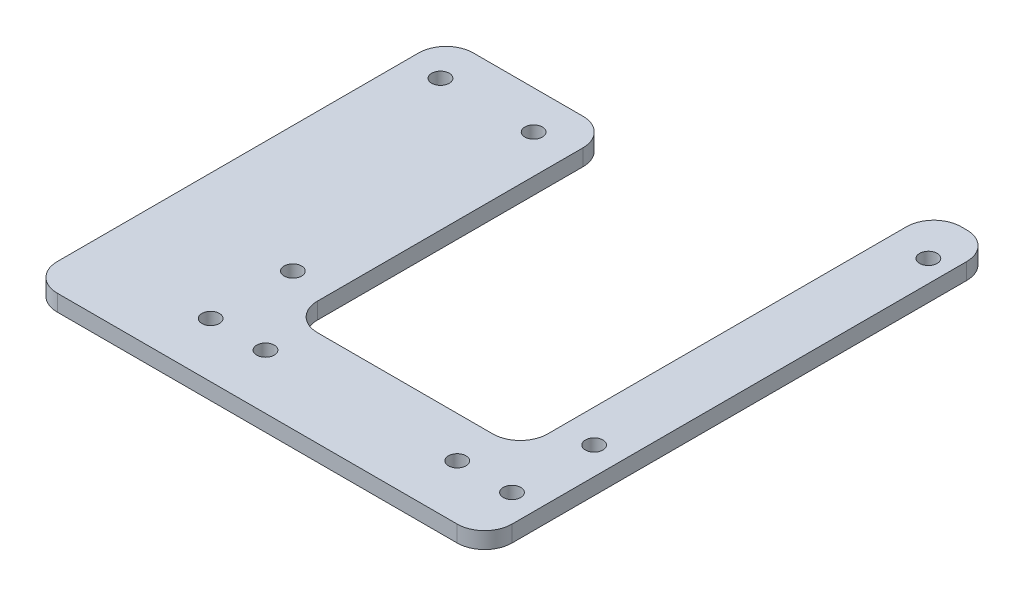
from build123d import *

# Parameters (mm, degrees)
EXTRUDE_1049_DEPTH      = 3
SKETCH_2_R              = 37.5
SKETCH_2_R_2            = 1.6
CUT_EXTRUDE_1714_DEPTH  = 3
SKETCH_8_W              = 65
SKETCH_8_H              = 25
CUT_EXTRUDE_2586_DEPTH  = 3
SKETCH_41_W             = 55
SKETCH_41_H             = 60
CUT_EXTRUDE_2_DEPTH     = 10
SKETCH_10_W             = 65
SKETCH_10_H             = 30
CUT_EXTRUDE_3792_DEPTH  = 3
SKETCH_11_R             = 1.6
SKETCH_11_W             = 42
SKETCH_11_H             = 28
CUT_EXTRUDE_4901_DEPTH  = 3
SKETCH_13_R             = 1.6
CUT_EXTRUDE_5557_DEPTH  = 3
SKETCH_14_R             = 2
CUT_EXTRUDE_5907_DEPTH  = 3
SKETCH_15_R             = 2
CUT_EXTRUDE_6167_DEPTH  = 3
SKETCH_16_R             = 1.6
CUT_EXTRUDE_6674_DEPTH  = 3
SKETCH_19_R             = 2
SKETCH_19_R_2           = 2.5
CUT_EXTRUDE_7840_DEPTH  = 3
SKETCH_21_R             = 1.6
CUT_EXTRUDE_7992_DEPTH  = 3
CUT_EXTRUDE_9_DEPTH     = 10
SKETCH_33_R             = 1.6
PC_DEPTH                = 10
SKETCH_36_R             = 1.6
CUT_EXTRUDE_9335_DEPTH  = 345.206333469
SKETCH_29_R             = 1.6
CUT_EXTRUDE_9717_DEPTH  = 10
SKETCH_39_R             = 1.6
CUT_EXTRUDE_10319_DEPTH = 10
SKETCH_42_W             = 40
SKETCH_42_H             = 40
CUT_EXTRUDE_11_DEPTH    = 10
SKETCH_34_R             = 1.6
UWB_DEPTH               = 10
SKETCH_47_R             = 1.6
CUT_EXTRUDE_13152_DEPTH = 345.206333469
SKETCH_48_R             = 1.6
CUT_EXTRUDE_14_DEPTH    = 345.206333469
CUT_EXTRUDE_6623_DEPTH  = 10
FILLET_13947_R          = 5
FILLET_14546_R          = 2
SKETCH_53_R             = 1.6
RFID_DEPTH              = 10
SKETCH_54_R             = 1.6
CUT_EXTRUDE_19167_DEPTH = 10
SKETCH_55_OUTSIDE_W     = 518.68
SKETCH_55_OUTSIDE_H     = 706.68
CUT_EXTRUDE_17_DEPTH    = 10
FILLET_1_R              = 5
SKETCH_56_W             = 16
SKETCH_56_H             = 59
CUT_EXTRUDE_18_DEPTH    = 10
SKETCH_57_R             = 1.55
CUT_EXTRUDE_19_DEPTH    = 10
SKETCH_59_R             = 1.6
CUT_EXTRUDE_20_DEPTH    = 10
FILLET_2_R              = 2
SKETCH_60_W             = 42
SKETCH_60_H             = 75.5
CUT_EXTRUDE_21_DEPTH    = 10
SKETCH_61_W             = 23.311710065
SKETCH_61_H             = 85.935142547
CUT_EXTRUDE_22_DEPTH    = 10
SKETCH_62_W             = 30
SKETCH_62_H             = 17.052631579
CUT_EXTRUDE_23_DEPTH    = 10
SKETCH_63_R             = 1.6
CUT_EXTRUDE_24_DEPTH    = 10
FILLET_3_R              = 5


with BuildPart() as part:
    # 草图1 → Extrude 1049 (new body)
    with BuildSketch(Plane(origin=(0, 0, 0), x_dir=(1, 0, 0), z_dir=(0, 1, 0))):
        Polygon((190, 287), (101.545, 287), (79.605689771, 249), (-79.605689771, 249), (-101.545, 287), (-190, 287), (-190, 0), (-190, -281), (-144.091695942, -281), (-98.660254038, -281), (-74.411542732, -239), (74.411542732, -239), (98.660254038, -281), (144.091695942, -281), (190, -281), (190, 0), align=None)
    extrude(amount=EXTRUDE_1049_DEPTH)

    # 草图2 → Cut-Extrude 1714 (cut)
    with BuildSketch(Plane(origin=(0, 3, 0), x_dir=(1, 0, 0), z_dir=(0, 1, 0))):
        Circle(SKETCH_2_R)
        with Locations((38.97114317, 22.5)):
            Circle(SKETCH_2_R_2)
        with Locations((0, -45)):
            Circle(SKETCH_2_R_2)
        with Locations((-38.97114317, 22.5)):
            Circle(SKETCH_2_R_2)
    extrude(amount=-CUT_EXTRUDE_1714_DEPTH, mode=Mode.SUBTRACT)

    # 草图8 → Cut-Extrude 2586 (cut)
    with BuildSketch(Plane(origin=(0, 3, 0), x_dir=(1, 0, 0), z_dir=(0, 1, 0))):
        with Locations((115, -161.5)):
            Rectangle(SKETCH_8_W, SKETCH_8_H)
        with Locations((-115, -161.5)):
            Rectangle(SKETCH_8_W, SKETCH_8_H)
    extrude(amount=-CUT_EXTRUDE_2586_DEPTH, mode=Mode.SUBTRACT)

    # 草图41 → 减重过线孔2 (cut)
    with BuildSketch(Plane(origin=(0, 3, 0), x_dir=(1, 0, 0), z_dir=(0, 1, 0))):
        with Locations((-102.5, 70)):
            Rectangle(SKETCH_41_W, SKETCH_41_H)
        with Locations((102.5, 70)):
            Rectangle(SKETCH_41_W, SKETCH_41_H)
        with Locations((102.5, -70)):
            Rectangle(SKETCH_41_W, SKETCH_41_H)
        with Locations((-102.5, -70)):
            Rectangle(SKETCH_41_W, SKETCH_41_H)
    extrude(amount=-CUT_EXTRUDE_2_DEPTH, mode=Mode.SUBTRACT)

    # 草图10 → Cut-Extrude 3792 (cut)
    with BuildSketch(Plane(origin=(0, 3, 0), x_dir=(1, 0, 0), z_dir=(0, 1, 0))):
        with Locations((-130, 167)):
            Rectangle(SKETCH_10_W, SKETCH_10_H)
        with Locations((130, 167)):
            Rectangle(SKETCH_10_W, SKETCH_10_H)
    extrude(amount=-CUT_EXTRUDE_3792_DEPTH, mode=Mode.SUBTRACT)

    # 草图11 → Cut-Extrude 4901 (cut)
    with BuildSketch(Plane(origin=(0, 3, 0), x_dir=(1, 0, 0), z_dir=(0, 1, 0))):
        with Locations((-153.5, 259)):
            Circle(SKETCH_11_R)
        with Locations((-162.5, 259)):
            Circle(SKETCH_11_R)
        with Locations((-153.5, 209)):
            Circle(SKETCH_11_R)
        with Locations((-162.5, 209)):
            Circle(SKETCH_11_R)
        with Locations((153.5, 259)):
            Circle(SKETCH_11_R)
        with Locations((162.5, 259)):
            Circle(SKETCH_11_R)
        with Locations((153.5, 209)):
            Circle(SKETCH_11_R)
        with Locations((162.5, 209)):
            Circle(SKETCH_11_R)
        with Locations((162.5, -209)):
            Circle(SKETCH_11_R)
        with Locations((153.5, -209)):
            Circle(SKETCH_11_R)
        with Locations((162.5, -259)):
            Circle(SKETCH_11_R)
        with Locations((153.5, -259)):
            Circle(SKETCH_11_R)
        with Locations((-162.5, -209)):
            Circle(SKETCH_11_R)
        with Locations((-153.5, -209)):
            Circle(SKETCH_11_R)
        with Locations((-153.5, -259)):
            Circle(SKETCH_11_R)
        with Locations((-162.5, -259)):
            Circle(SKETCH_11_R)
        with Locations((-158, 234)):
            Rectangle(SKETCH_11_W, SKETCH_11_H)
        with Locations((158, 234)):
            Rectangle(SKETCH_11_W, SKETCH_11_H)
        with Locations((158, -234)):
            Rectangle(SKETCH_11_W, SKETCH_11_H)
        with Locations((-158, -234)):
            Rectangle(SKETCH_11_W, SKETCH_11_H)
    extrude(amount=-CUT_EXTRUDE_4901_DEPTH, mode=Mode.SUBTRACT)

    # 草图13 → Cut-Extrude 5557 (cut)
    with BuildSketch(Plane(origin=(0, 3, 0), x_dir=(1, 0, 0), z_dir=(0, 1, 0))):
        with Locations((25, 176)):
            Circle(SKETCH_13_R)
        with Locations((25, 226)):
            Circle(SKETCH_13_R)
        with Locations((-25, 226)):
            Circle(SKETCH_13_R)
        with Locations((-25, 176)):
            Circle(SKETCH_13_R)
    extrude(amount=-CUT_EXTRUDE_5557_DEPTH, mode=Mode.SUBTRACT)

    # 草图14 → Cut-Extrude 5907 (cut)
    with BuildSketch(Plane(origin=(0, 3, 0), x_dir=(1, 0, 0), z_dir=(0, 1, 0))):
        with Locations((-47.5, 239)):
            Circle(SKETCH_14_R)
        with Locations((-47.5, 214)):
            Circle(SKETCH_14_R)
        with Locations((47.5, 214)):
            Circle(SKETCH_14_R)
        with Locations((47.5, 239)):
            Circle(SKETCH_14_R)
        with Locations((-47.5, -207)):
            Circle(SKETCH_14_R)
        with Locations((-47.5, -232)):
            Circle(SKETCH_14_R)
        with Locations((47.5, -232)):
            Circle(SKETCH_14_R)
        with Locations((47.5, -207)):
            Circle(SKETCH_14_R)
    extrude(amount=-CUT_EXTRUDE_5907_DEPTH, mode=Mode.SUBTRACT)

    # 草图15 → Cut-Extrude 6167 (cut)
    with BuildSketch(Plane(origin=(0, 3, 0), x_dir=(1, 0, 0), z_dir=(0, 1, 0))):
        with Locations((155, 47.5)):
            Circle(SKETCH_15_R)
        with Locations((180, 47.5)):
            Circle(SKETCH_15_R)
        with Locations((180, -47.5)):
            Circle(SKETCH_15_R)
        with Locations((155, -47.5)):
            Circle(SKETCH_15_R)
        with Locations((-155, -47.5)):
            Circle(SKETCH_15_R)
        with Locations((-180, -47.5)):
            Circle(SKETCH_15_R)
        with Locations((-180, 47.5)):
            Circle(SKETCH_15_R)
        with Locations((-155, 47.5)):
            Circle(SKETCH_15_R)
    extrude(amount=-CUT_EXTRUDE_6167_DEPTH, mode=Mode.SUBTRACT)

    # 草图16 → Cut-Extrude 6674 (cut)
    with BuildSketch(Plane(origin=(0, 3, 0), x_dir=(1, 0, 0), z_dir=(0, 1, 0))):
        with Locations((-64, 229)):
            Circle(SKETCH_16_R)
        with Locations((-64, 117)):
            Circle(SKETCH_16_R)
        with Locations((-64, 5)):
            Circle(SKETCH_16_R)
        with Locations((-64, -107)):
            Circle(SKETCH_16_R)
        with Locations((-64, -219)):
            Circle(SKETCH_16_R)
        with Locations((64, 229)):
            Circle(SKETCH_16_R)
        with Locations((64, -107)):
            Circle(SKETCH_16_R)
        with Locations((64, 5)):
            Circle(SKETCH_16_R)
        with Locations((64, 117)):
            Circle(SKETCH_16_R)
        with Locations((64, -219)):
            Circle(SKETCH_16_R)
    extrude(amount=-CUT_EXTRUDE_6674_DEPTH, mode=Mode.SUBTRACT)

    # 草图19 → Cut-Extrude 7840 (cut)
    with BuildSketch(Plane(origin=(0, 3, 0), x_dir=(1, 0, 0), z_dir=(0, 1, 0))):
        with Locations((-177.5, -78)):
            Circle(SKETCH_19_R)
        with Locations((-177.5, -94)):
            Circle(SKETCH_19_R_2)
        with Locations((-177.5, 94)):
            Circle(SKETCH_19_R_2)
        with Locations((-177.5, 78)):
            Circle(SKETCH_19_R)
        with Locations((177.5, -94)):
            Circle(SKETCH_19_R_2)
        with Locations((177.5, -78)):
            Circle(SKETCH_19_R)
        with Locations((177.5, 78)):
            Circle(SKETCH_19_R)
        with Locations((177.5, 94)):
            Circle(SKETCH_19_R_2)
    extrude(amount=-CUT_EXTRUDE_7840_DEPTH, mode=Mode.SUBTRACT)

    # 草图21 → Cut-Extrude 7992 (cut)
    with BuildSketch(Plane(origin=(0, 3, 0), x_dir=(1, 0, 0), z_dir=(0, 1, 0))):
        with Locations((0, -93)):
            Circle(SKETCH_21_R)
    extrude(amount=-CUT_EXTRUDE_7992_DEPTH, mode=Mode.SUBTRACT)

    # 草图32 → 切除-拉伸9 (cut)
    with BuildSketch(Plane(origin=(0, 3, 0), x_dir=(1, 0, 0), z_dir=(0, 1, 0))):
        with BuildLine():
            Line((-34.5, -190), (34.5, -190))
            ThreePointArc((34.5, -190), (36.621320344, -189.121320344), (37.5, -187))
            Line((37.5, -187), (37.5, -133))
            ThreePointArc((37.5, -133), (36.621320344, -130.878679656), (34.5, -130))
            Line((34.5, -130), (-34.5, -130))
            ThreePointArc((-34.5, -130), (-36.621320344, -130.878679656), (-37.5, -133))
            Line((-37.5, -133), (-37.5, -187))
            ThreePointArc((-37.5, -187), (-36.621320344, -189.121320344), (-34.5, -190))
        make_face()
    extrude(amount=-CUT_EXTRUDE_9_DEPTH, mode=Mode.SUBTRACT)

    # 草图33 → PC座固定孔 (cut)
    with BuildSketch(Plane(origin=(0, 3, 0), x_dir=(1, 0, 0), z_dir=(0, 1, 0))):
        with Locations((-42.5, -120.5)):
            Circle(SKETCH_33_R)
        with Locations((42.5, -120.5)):
            Circle(SKETCH_33_R)
    extrude(amount=-PC_DEPTH, mode=Mode.SUBTRACT)

    # 草图36 → Cut-Extrude 9335 (cut, through all)
    with BuildSketch(Plane(origin=(0, 3, 0), x_dir=(1, 0, 0), z_dir=(0, 1, 0))):
        with Locations((-80, -231)):
            Circle(SKETCH_36_R)
        with Locations((-80, -219)):
            Circle(SKETCH_36_R)
        with Locations((80, -219)):
            Circle(SKETCH_36_R)
        with Locations((80, -231)):
            Circle(SKETCH_36_R)
        with Locations((-80, 241)):
            Circle(SKETCH_36_R)
        with Locations((-80, 229)):
            Circle(SKETCH_36_R)
        with Locations((80, 229)):
            Circle(SKETCH_36_R)
        with Locations((80, 241)):
            Circle(SKETCH_36_R)
    extrude(amount=-CUT_EXTRUDE_9335_DEPTH, mode=Mode.SUBTRACT)

    # 草图29 → Cut-Extrude 9717 (cut)
    with BuildSketch(Plane(origin=(0, 3, 0), x_dir=(1, 0, 0), z_dir=(0, 1, 0))):
        with Locations((48, 120)):
            Circle(SKETCH_29_R)
        with Locations((0, 86)):
            Circle(SKETCH_29_R)
        with Locations((0, 154)):
            Circle(SKETCH_29_R)
        with Locations((-48, 120)):
            Circle(SKETCH_29_R)
        with BuildLine():
            Line((40, 98), (40, 142))
            ThreePointArc((40, 142), (39.121320344, 144.121320344), (37, 145))
            Line((37, 145), (-37, 145))
            ThreePointArc((-37, 145), (-39.121320344, 144.121320344), (-40, 142))
            Line((-40, 142), (-40, 98))
            ThreePointArc((-40, 98), (-39.121320344, 95.878679656), (-37, 95))
            Line((-37, 95), (37, 95))
            ThreePointArc((37, 95), (39.121320344, 95.878679656), (40, 98))
        make_face()
    extrude(amount=-CUT_EXTRUDE_9717_DEPTH, mode=Mode.SUBTRACT)

    # 草图39 → Cut-Extrude 10319 (cut)
    with BuildSketch(Plane(origin=(0, 3, 0), x_dir=(1, 0, 0), z_dir=(0, 1, 0))):
        with Locations((185, -271)):
            Circle(SKETCH_39_R)
        with Locations((185, -256)):
            Circle(SKETCH_39_R)
        with Locations((130, -256)):
            Circle(SKETCH_39_R)
        with Locations((130, -271)):
            Circle(SKETCH_39_R)
        with Locations((-130, -271)):
            Circle(SKETCH_39_R)
        with Locations((-130, -256)):
            Circle(SKETCH_39_R)
        with Locations((-185, -256)):
            Circle(SKETCH_39_R)
        with Locations((-185, -271)):
            Circle(SKETCH_39_R)
        with Locations((-130, 262)):
            Circle(SKETCH_39_R)
        with Locations((-130, 277)):
            Circle(SKETCH_39_R)
        with Locations((185, 262)):
            Circle(SKETCH_39_R)
        with Locations((185, 277)):
            Circle(SKETCH_39_R)
        with Locations((-185, 277)):
            Circle(SKETCH_39_R)
        with Locations((-185, 262)):
            Circle(SKETCH_39_R)
        with Locations((130, 277)):
            Circle(SKETCH_39_R)
        with Locations((130, 262)):
            Circle(SKETCH_39_R)
    extrude(amount=-CUT_EXTRUDE_10319_DEPTH, mode=Mode.SUBTRACT)

    # 草图42 → 切除-拉伸11 (cut)
    with BuildSketch(Plane(origin=(0, 3, 0), x_dir=(1, 0, 0), z_dir=(0, 1, 0))):
        with Locations((0, 201)):
            Rectangle(SKETCH_42_W, SKETCH_42_H)
    extrude(amount=-CUT_EXTRUDE_11_DEPTH, mode=Mode.SUBTRACT)

    # 草图34 → UWB固定孔 (cut)
    with BuildSketch(Plane(origin=(0, 3, 0), x_dir=(1, 0, 0), z_dir=(0, 1, 0))):
        with Locations((90, 168)):
            Circle(SKETCH_34_R)
        with Locations((71, 187)):
            Circle(SKETCH_34_R)
        with Locations((90, 206)):
            Circle(SKETCH_34_R)
        with Locations((109, 187)):
            Circle(SKETCH_34_R)
    extrude(amount=-UWB_DEPTH, mode=Mode.SUBTRACT)

    # 草图47 → Cut-Extrude 13152 (cut, through all)
    with BuildSketch(Plane(origin=(0, 3, 0), x_dir=(1, 0, 0), z_dir=(0, 1, 0))):
        with Locations((140, 277)):
            Circle(SKETCH_47_R)
        with Locations((185, -271)):
            Circle(SKETCH_47_R)
        with Locations((95, -231)):
            Circle(SKETCH_47_R)
        with Locations((175, -271)):
            Circle(SKETCH_47_R)
        with Locations((140, 213)):
            Circle(SKETCH_47_R)
        with Locations((175, -207)):
            Circle(SKETCH_47_R)
        with Locations((-140, -271)):
            Circle(SKETCH_47_R)
        with Locations((-140, -207)):
            Circle(SKETCH_47_R)
        with Locations((-175, 213)):
            Circle(SKETCH_47_R)
        with Locations((-95, 237)):
            Circle(SKETCH_47_R)
        with Locations((185, 277)):
            Circle(SKETCH_47_R)
        with Locations((175, 277)):
            Circle(SKETCH_47_R)
        with Locations((95, 237)):
            Circle(SKETCH_47_R)
        with Locations((175, 213)):
            Circle(SKETCH_47_R)
        with Locations((-175, 277)):
            Circle(SKETCH_47_R)
        with Locations((-185, 277)):
            Circle(SKETCH_47_R)
        with Locations((140, -207)):
            Circle(SKETCH_47_R)
        with Locations((140, -271)):
            Circle(SKETCH_47_R)
        with Locations((-175, -207)):
            Circle(SKETCH_47_R)
        with Locations((-140, 213)):
            Circle(SKETCH_47_R)
        with Locations((-175, -271)):
            Circle(SKETCH_47_R)
        with Locations((-95, -231)):
            Circle(SKETCH_47_R)
        with Locations((-185, -271)):
            Circle(SKETCH_47_R)
        with Locations((-140, 277)):
            Circle(SKETCH_47_R)
    extrude(amount=-CUT_EXTRUDE_13152_DEPTH, mode=Mode.SUBTRACT)

    # 草图48 → 切除-拉伸14 (cut, through all)
    with BuildSketch(Plane(origin=(0, 3, 0), x_dir=(1, 0, 0), z_dir=(0, 1, 0))):
        with Locations((-44.5, -46)):
            Circle(SKETCH_48_R)
        with Locations((44.5, -46)):
            Circle(SKETCH_48_R)
        with Locations((-9, -196)):
            Circle(SKETCH_48_R)
        with Locations((9, -196)):
            Circle(SKETCH_48_R)
    extrude(amount=-CUT_EXTRUDE_14_DEPTH, mode=Mode.SUBTRACT)

    # 草图51 → 6623电机过线孔 (cut)
    with BuildSketch(Plane(origin=(0, 3, 0), x_dir=(1, 0, 0), z_dir=(0, 1, 0))):
        with BuildLine():
            Line((-20.5, 67.5), (20.5, 67.5))
            ThreePointArc((20.5, 67.5), (21.914213562, 66.914213562), (22.5, 65.5))
            Line((22.5, 65.5), (22.5, 54.5))
            ThreePointArc((22.5, 54.5), (21.914213562, 53.085786438), (20.5, 52.5))
            Line((20.5, 52.5), (-20.5, 52.5))
            ThreePointArc((-20.5, 52.5), (-21.914213562, 53.085786438), (-22.5, 54.5))
            Line((-22.5, 54.5), (-22.5, 65.5))
            ThreePointArc((-22.5, 65.5), (-21.914213562, 66.914213562), (-20.5, 67.5))
        make_face()
    extrude(amount=-CUT_EXTRUDE_6623_DEPTH, mode=Mode.SUBTRACT)

    # Fillet 13947
    fillet_13947_edges = [part.edges().sort_by_distance(p)[0] for p in [
        (-190, 1.5, -287),
        (-101.545, 1.5, -287),
        (-79.605689771, 1.5, -249),
        (79.605689771, 1.5, -249),
        (101.545, 1.5, -287),
        (190, 1.5, -287),
        (190, 1.5, 281),
        (98.660254038, 1.5, 281),
        (74.411542732, 1.5, 239),
        (-74.411542732, 1.5, 239),
        (-98.660254038, 1.5, 281),
        (-190, 1.5, 281),
    ]]
    fillet(fillet_13947_edges, radius=FILLET_13947_R)

    # Fillet 14546
    fillet_14546_edges = [part.edges().sort_by_distance(p)[0] for p in [
        (-147.5, 1.5, 149),
        (-82.5, 1.5, 149),
        (-82.5, 1.5, 174),
        (-147.5, 1.5, 174),
        (82.5, 1.5, 149),
        (147.5, 1.5, 149),
        (147.5, 1.5, 174),
        (82.5, 1.5, 174),
        (-130, 1.5, -100),
        (-75, 1.5, -100),
        (-75, 1.5, -40),
        (-130, 1.5, -40),
        (-130, 1.5, 100),
        (-130, 1.5, 40),
        (-75, 1.5, 40),
        (-75, 1.5, 100),
        (130, 1.5, 100),
        (75, 1.5, 100),
        (75, 1.5, 40),
        (130, 1.5, 40),
        (130, 1.5, -100),
        (130, 1.5, -40),
        (75, 1.5, -40),
        (75, 1.5, -100),
        (-97.5, 1.5, -152),
        (-162.5, 1.5, -152),
        (-162.5, 1.5, -182),
        (-97.5, 1.5, -182),
        (162.5, 1.5, -182),
        (-137, 1.5, -220),
        (-179, 1.5, -220),
        (-179, 1.5, -248),
        (-137, 1.5, -248),
        (-179, 1.5, 220),
        (-137, 1.5, 220),
        (-137, 1.5, 248),
        (179, 1.5, 248),
        (137, 1.5, 248),
        (137, 1.5, 220),
        (179, 1.5, 220),
        (179, 1.5, -248),
        (179, 1.5, -220),
        (137, 1.5, -220),
        (137, 1.5, -248),
        (20, 1.5, -181),
        (-20, 1.5, -181),
        (-20, 1.5, -221),
        (20, 1.5, -221),
        (-179, 1.5, 248),
        (162.5, 1.5, -152),
        (97.5, 1.5, -152),
        (97.5, 1.5, -182),
    ]]
    fillet(fillet_14546_edges, radius=FILLET_14546_R)

    # 草图53 → RFID固定孔 (cut)
    with BuildSketch(Plane(origin=(0, 3, 0), x_dir=(1, 0, 0), z_dir=(0, 1, 0))):
        with Locations((-135, -31)):
            Circle(SKETCH_53_R)
        with Locations((-85, -31)):
            Circle(SKETCH_53_R)
        with Locations((-85, 31)):
            Circle(SKETCH_53_R)
        with Locations((-135, 31)):
            Circle(SKETCH_53_R)
        with Locations((135, 31)):
            Circle(SKETCH_53_R)
        with Locations((85, 31)):
            Circle(SKETCH_53_R)
        with Locations((85, -31)):
            Circle(SKETCH_53_R)
        with Locations((135, -31)):
            Circle(SKETCH_53_R)
    extrude(amount=-RFID_DEPTH, mode=Mode.SUBTRACT)

    # 草图54 → Cut-Extrude 19167 (cut)
    with BuildSketch(Plane.XZ):
        with Locations((-102.122350269, -278)):
            Circle(SKETCH_54_R)
        with Locations((-92.122350269, -260.679491924)):
            Circle(SKETCH_54_R)
        with Locations((92.122350269, -260.679491924)):
            Circle(SKETCH_54_R)
        with Locations((102.122350269, -278)):
            Circle(SKETCH_54_R)
        with Locations((102.122350269, 272)):
            Circle(SKETCH_54_R)
        with Locations((92.122350269, 254.679491924)):
            Circle(SKETCH_54_R)
        with Locations((-92.122350269, 254.679491924)):
            Circle(SKETCH_54_R)
        with Locations((-102.122350269, 272)):
            Circle(SKETCH_54_R)
    extrude(amount=-CUT_EXTRUDE_19167_DEPTH, mode=Mode.SUBTRACT)

    # 草图55 outside → 切除-拉伸17 (cut)
    with BuildSketch(Plane.XZ):
        with Locations((0, -3)):
            Rectangle(SKETCH_55_OUTSIDE_W, SKETCH_55_OUTSIDE_H)
        with BuildLine():
            Line((190, 281), (101.547005384, 281))
            ThreePointArc((101.547005384, 281), (99.047005384, 280.330127019), (97.216878365, 278.5))
            Line((97.216878365, 278.5), (87, 260.803847577))
            Line((87, 260.803847577), (87, 224))
            Line((87, 224), (125, 188))
            Line((125, 188), (190, 188))
            Line((190, 188), (190, 281))
        make_face(mode=Mode.SUBTRACT)
    extrude(amount=-CUT_EXTRUDE_17_DEPTH, mode=Mode.SUBTRACT)

    # 圆角1
    fillet_1_edges = [part.edges().sort_by_distance(p)[0] for p in [
        (190, 1.5, 188),
        (87, 1.5, 260.803847577),
        (87, 1.5, 224),
        (125, 1.5, 188),
    ]]
    fillet(fillet_1_edges, radius=FILLET_1_R)

    # 草图56 → 切除-拉伸18 (cut)
    with BuildSketch(Plane.XZ):
        with Locations((158, 234)):
            Rectangle(SKETCH_56_W, SKETCH_56_H)
    extrude(amount=-CUT_EXTRUDE_18_DEPTH, mode=Mode.SUBTRACT)

    # 草图57 → 切除-拉伸19 (cut)
    with BuildSketch(Plane.XZ):
        with Locations((150, 206.05)):
            Circle(SKETCH_57_R)
        with Locations((166, 206.05)):
            Circle(SKETCH_57_R)
        with Locations((166, 261.95)):
            Circle(SKETCH_57_R)
        with Locations((150, 261.95)):
            Circle(SKETCH_57_R)
    extrude(amount=-CUT_EXTRUDE_19_DEPTH, mode=Mode.SUBTRACT)

    # 草图59 → 切除-拉伸20 (cut)
    with BuildSketch(Plane.XZ):
        with Locations((130, 196)):
            Circle(SKETCH_59_R)
        with Locations((186, 196)):
            Circle(SKETCH_59_R)
    extrude(amount=-CUT_EXTRUDE_20_DEPTH, mode=Mode.SUBTRACT)

    # 圆角2
    fillet_2_edges = [part.edges().sort_by_distance(p)[0] for p in [
        (150, 1.5, 248),
        (166, 1.5, 248),
        (166, 1.5, 220),
        (150, 1.5, 220),
    ]]
    fillet(fillet_2_edges, radius=FILLET_2_R)

    # 草图60 → 切除-拉伸21 (cut)
    with BuildSketch(Plane.XZ):
        with Locations((158, 225.75)):
            Rectangle(SKETCH_60_W, SKETCH_60_H)
    extrude(amount=-CUT_EXTRUDE_21_DEPTH, mode=Mode.SUBTRACT)

    # 草图61 → 切除-拉伸22 (cut)
    with BuildSketch(Plane.XZ):
        with Locations((95.344144968, 238.032428727)):
            Rectangle(SKETCH_61_W, SKETCH_61_H)
    extrude(amount=-CUT_EXTRUDE_22_DEPTH, mode=Mode.SUBTRACT)

    # 草图62 → 切除-拉伸23 (cut)
    with BuildSketch(Plane.XZ):
        with Locations((122, 196.52631579)):
            Rectangle(SKETCH_62_W, SKETCH_62_H)
    extrude(amount=-CUT_EXTRUDE_23_DEPTH, mode=Mode.SUBTRACT)

    # 草图63 → 切除-拉伸24 (cut)
    with BuildSketch(Plane(origin=(0, 3, 0), x_dir=(1, 0, 0), z_dir=(0, 1, 0))):
        with Locations((130, -212.052631579)):
            Circle(SKETCH_63_R)
        with Locations((113, -212.052631579)):
            Circle(SKETCH_63_R)
    extrude(amount=-CUT_EXTRUDE_24_DEPTH, mode=Mode.SUBTRACT)

    # 圆角3
    fillet_3_edges = [part.edges().sort_by_distance(p)[0] for p in [
        (179, 1.5, 263.5),
        (179, 1.5, 188),
        (107, 1.5, 281),
        (107, 1.5, 205.052631579),
        (137, 1.5, 205.052631579),
        (137, 1.5, 263.5),
    ]]
    fillet(fillet_3_edges, radius=FILLET_3_R)


solid = part.part
